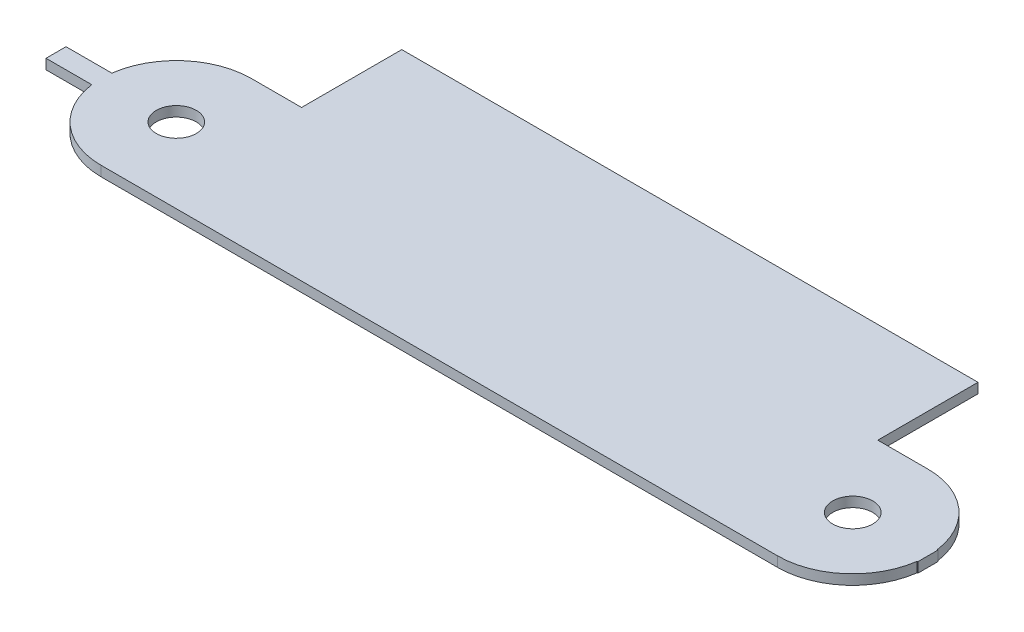
from build123d import *

# Parameters (mm, degrees)
SKETCH1_R           = 2
BOSS_EXTRUDE1_DEPTH = 1


with BuildPart() as part:
    # Sketch1 → Boss-Extrude1 (new body)
    with BuildSketch(Plane(origin=(0, 0, 0), x_dir=(1, 0, 0), z_dir=(0, 1, 0))):
        with BuildLine():
            Line((5, 7.5), (0, 7.5))
            ThreePointArc((0, 7.5), (-4.937104415, 5.645794895), (-7.433034374, 1))
            Line((-7.433034374, 1), (-12.003034374, 1))
            Line((-12.003034374, 1), (-12.003034374, -1))
            Line((-12.003034374, -1), (-7.433034374, -1))
            ThreePointArc((-7.433034374, -1), (-4.937104415, -5.645794895), (0, -7.5))
            Line((0, -7.5), (67.5, -7.5))
            ThreePointArc((67.5, -7.5), (72.437104415, -5.645794895), (74.933034374, -1))
            Line((74.933034374, -1), (75, -1))
            Line((75, -1), (75, 1))
            Line((75, 1), (74.933034374, 1))
            ThreePointArc((74.933034374, 1), (72.437104415, 5.645794895), (67.5, 7.5))
            Line((67.5, 7.5), (62.5, 7.5))
            Line((62.5, 7.5), (62.5, 17.5))
            Line((62.5, 17.5), (5, 17.5))
            Line((5, 17.5), (5, 7.5))
        make_face()
        Circle(SKETCH1_R, mode=Mode.SUBTRACT)
        with Locations((67.5, 0)):
            Circle(SKETCH1_R, mode=Mode.SUBTRACT)
    extrude(amount=BOSS_EXTRUDE1_DEPTH)


solid = part.part
